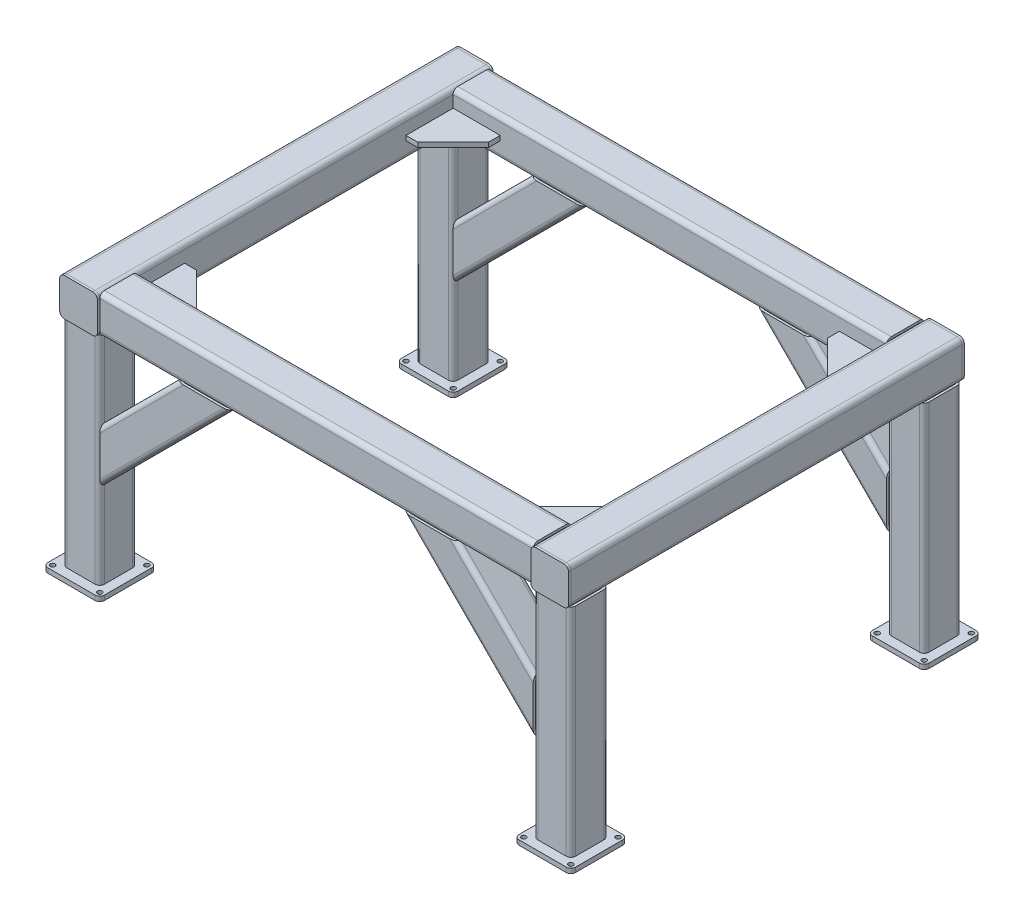
from build123d import *

# Parameters (mm, degrees)
SQUARE_TUBE_80_X_80_X_5_1_DEPTH      = 790
SQUARE_TUBE_80_X_80_X_5_1_DEPTH_BACK = 40
SQUARE_TUBE_80_X_80_X_5_1_2_DEPTH    = 830
SQUARE_TUBE_80_X_80_X_5_1_3_DEPTH    = 1002
SQUARE_TUBE_80_X_80_X_5_1_4_DEPTH    = 1002
SQUARE_TUBE_80_X_80_X_5_2_DEPTH      = 500
SQUARE_TUBE_80_X_80_X_5_2_2_DEPTH    = 500
SQUARE_TUBE_80_X_80_X_5_2_3_DEPTH    = 500
SQUARE_TUBE_80_X_80_X_5_2_4_DEPTH    = 500
SQUARE_TUBE_80_X_80_X_5_2_5_DEPTH    = 481.832611207
SQUARE_TUBE_80_X_80_X_5_2_6_DEPTH    = 481.832611207
SQUARE_TUBE_80_X_80_X_5_2_7_DEPTH    = 481.832611207
SQUARE_TUBE_80_X_80_X_5_2_8_DEPTH    = 481.832611207
END_CAP1_THICKNESS                   = 5
END_CAP1_4_THICKNESS                 = 5
END_CAP1_7_THICKNESS                 = 5
END_CAP1_10_THICKNESS                = 5
BOSS_EXTRUDE1_DEPTH                  = 10
BOSS_EXTRUDE1_2_DEPTH                = 10
BOSS_EXTRUDE1_3_DEPTH                = 10
BOSS_EXTRUDE1_4_DEPTH                = 10
SKETCH14_W                           = 5
SKETCH14_H                           = 550
F_10_0MM_DOWEL_HOLE1_AT_2_COUNT      = 2
F_10_0MM_DOWEL_HOLE1_AT_2_PITCH      = 100
F_10_0MM_DOWEL_HOLE1_AT_3_COUNT      = 2
F_10_0MM_DOWEL_HOLE1_AT_3_PITCH      = 100
F_10_0MM_DOWEL_HOLE1_AT_4_COUNT      = 2
F_10_0MM_DOWEL_HOLE1_AT_4_PITCH      = 141.421356237
F_10_0MM_DOWEL_HOLE1_AT_5_COUNT      = 2
F_10_0MM_DOWEL_HOLE1_AT_5_PITCH      = 750
F_10_0MM_DOWEL_HOLE1_AT_6_COUNT      = 2
F_10_0MM_DOWEL_HOLE1_AT_6_PITCH      = 756.637297521
F_10_0MM_DOWEL_HOLE1_AT_7_COUNT      = 2
F_10_0MM_DOWEL_HOLE1_AT_7_PITCH      = 855.862138431
F_10_0MM_DOWEL_HOLE1_AT_8_COUNT      = 2
F_10_0MM_DOWEL_HOLE1_AT_8_PITCH      = 850
MIRROR1_COPY_1_SKETCH_W              = 5
MIRROR1_COPY_1_SKETCH_H              = 550
MIRROR1_COPY_2_SKETCH_W              = 5
MIRROR1_COPY_2_SKETCH_H              = 550
MIRROR1_COPY_3_SKETCH_W              = 5
MIRROR1_COPY_3_SKETCH_H              = 550
MIRROR1_COPY_4_SKETCH_W              = 5
MIRROR1_COPY_4_SKETCH_H              = 550
MIRROR1_COPY_5_SKETCH_W              = 5
MIRROR1_COPY_5_SKETCH_H              = 550
MIRROR1_COPY_6_SKETCH_W              = 5
MIRROR1_COPY_6_SKETCH_H              = 550
MIRROR1_COPY_7_SKETCH_W              = 5
MIRROR1_COPY_7_SKETCH_H              = 550
GUSSET1_THICKNESS                    = 10
GUSSET2_THICKNESS                    = 10
MIRROR2_START                        = -5
MIRROR2_DEPTH                        = 10


# Read off the part's stored shape, not the designer's step: Mirror2
with BuildPart() as part:
    # Sketch11 → Square tube 80 X 80 X 5(1) (new, two sides: drawn at the far end of the back side and taken through both)
    with BuildSketch(Plane(origin=(500, 0, 375), x_dir=(-1, 0, 0), z_dir=(0, 0, -1)).offset(-SQUARE_TUBE_80_X_80_X_5_1_DEPTH_BACK)):
        with BuildLine():
            Line((-30, -40), (30, -40))
            ThreePointArc((30, -40), (37.071067812, -37.071067812), (40, -30))
            Line((40, -30), (40, 30))
            ThreePointArc((40, 30), (37.071067812, 37.071067812), (30, 40))
            Line((30, 40), (-30, 40))
            ThreePointArc((-30, 40), (-37.071067812, 37.071067812), (-40, 30))
            Line((-40, 30), (-40, -30))
            ThreePointArc((-40, -30), (-37.071067812, -37.071067812), (-30, -40))
        make_face()
        with BuildLine():
            Line((-30, -35), (30, -35))
            ThreePointArc((30, -35), (33.535533906, -33.535533906), (35, -30))
            Line((35, -30), (35, 30))
            ThreePointArc((35, 30), (33.535533906, 33.535533906), (30, 35))
            Line((30, 35), (-30, 35))
            ThreePointArc((-30, 35), (-33.535533906, 33.535533906), (-35, 30))
            Line((-35, 30), (-35, -30))
            ThreePointArc((-35, -30), (-33.535533906, -33.535533906), (-30, -35))
        make_face(mode=Mode.SUBTRACT)
    extrude(amount=SQUARE_TUBE_80_X_80_X_5_1_DEPTH + SQUARE_TUBE_80_X_80_X_5_1_DEPTH_BACK)


with BuildPart() as body_2:
    # Sketch11 on segment 2 (carried to segment 2) → Square tube 80 X 80 X 5_1 2 (new body)
    with BuildSketch(Plane(origin=(-500, 0, 415), x_dir=(-1, 0, 0), z_dir=(0, 0, -1))):
        with BuildLine():
            Line((-30, -40), (30, -40))
            ThreePointArc((30, -40), (37.071067812, -37.071067812), (40, -30))
            Line((40, -30), (40, 30))
            ThreePointArc((40, 30), (37.071067812, 37.071067812), (30, 40))
            Line((30, 40), (-30, 40))
            ThreePointArc((-30, 40), (-37.071067812, 37.071067812), (-40, 30))
            Line((-40, 30), (-40, -30))
            ThreePointArc((-40, -30), (-37.071067812, -37.071067812), (-30, -40))
        make_face()
        with BuildLine():
            Line((-30, -35), (30, -35))
            ThreePointArc((30, -35), (33.535533906, -33.535533906), (35, -30))
            Line((35, -30), (35, 30))
            ThreePointArc((35, 30), (33.535533906, 33.535533906), (30, 35))
            Line((30, 35), (-30, 35))
            ThreePointArc((-30, 35), (-33.535533906, 33.535533906), (-35, 30))
            Line((-35, 30), (-35, -30))
            ThreePointArc((-35, -30), (-33.535533906, -33.535533906), (-30, -35))
        make_face(mode=Mode.SUBTRACT)
    extrude(amount=SQUARE_TUBE_80_X_80_X_5_1_2_DEPTH)


with BuildPart() as body_3:
    # Sketch11 on segment 3 (carried to segment 3) → Square tube 80 X 80 X 5_1 3 (new body)
    with BuildSketch(Plane(origin=(-501, 0, 375), x_dir=(0, 0, -1), z_dir=(1, 0, 0))):
        with BuildLine():
            Line((-30, -40), (30, -40))
            ThreePointArc((30, -40), (37.071067812, -37.071067812), (40, -30))
            Line((40, -30), (40, 30))
            ThreePointArc((40, 30), (37.071067812, 37.071067812), (30, 40))
            Line((30, 40), (-30, 40))
            ThreePointArc((-30, 40), (-37.071067812, 37.071067812), (-40, 30))
            Line((-40, 30), (-40, -30))
            ThreePointArc((-40, -30), (-37.071067812, -37.071067812), (-30, -40))
        make_face()
        with BuildLine():
            Line((-30, -35), (30, -35))
            ThreePointArc((30, -35), (33.535533906, -33.535533906), (35, -30))
            Line((35, -30), (35, 30))
            ThreePointArc((35, 30), (33.535533906, 33.535533906), (30, 35))
            Line((30, 35), (-30, 35))
            ThreePointArc((-30, 35), (-33.535533906, 33.535533906), (-35, 30))
            Line((-35, 30), (-35, -30))
            ThreePointArc((-35, -30), (-33.535533906, -33.535533906), (-30, -35))
        make_face(mode=Mode.SUBTRACT)
    extrude(amount=SQUARE_TUBE_80_X_80_X_5_1_3_DEPTH)

    # Square tube 80 X 80 X 5_1 3 end butt 1
    split(bisect_by=Plane(origin=(-460, 0, 375), x_dir=(0, 1, 0), z_dir=(1, 0, 0)), keep=Keep.TOP)

    # Square tube 80 X 80 X 5_1 3 end butt 2
    split(bisect_by=Plane(origin=(460, 0, 375), x_dir=(0, -1, 0), z_dir=(-1, 0, 0)), keep=Keep.TOP)


with BuildPart() as body_4:
    # Sketch11 on segment 4 (carried to segment 4) → Square tube 80 X 80 X 5_1 4 (new body)
    with BuildSketch(Plane(origin=(-501, 0, -375), x_dir=(0, 0, -1), z_dir=(1, 0, 0))):
        with BuildLine():
            Line((-30, -40), (30, -40))
            ThreePointArc((30, -40), (37.071067812, -37.071067812), (40, -30))
            Line((40, -30), (40, 30))
            ThreePointArc((40, 30), (37.071067812, 37.071067812), (30, 40))
            Line((30, 40), (-30, 40))
            ThreePointArc((-30, 40), (-37.071067812, 37.071067812), (-40, 30))
            Line((-40, 30), (-40, -30))
            ThreePointArc((-40, -30), (-37.071067812, -37.071067812), (-30, -40))
        make_face()
        with BuildLine():
            Line((-30, -35), (30, -35))
            ThreePointArc((30, -35), (33.535533906, -33.535533906), (35, -30))
            Line((35, -30), (35, 30))
            ThreePointArc((35, 30), (33.535533906, 33.535533906), (30, 35))
            Line((30, 35), (-30, 35))
            ThreePointArc((-30, 35), (-33.535533906, 33.535533906), (-35, 30))
            Line((-35, 30), (-35, -30))
            ThreePointArc((-35, -30), (-33.535533906, -33.535533906), (-30, -35))
        make_face(mode=Mode.SUBTRACT)
    extrude(amount=SQUARE_TUBE_80_X_80_X_5_1_4_DEPTH)

    # Square tube 80 X 80 X 5_1 4 end butt 1
    split(bisect_by=Plane(origin=(-460, 0, -375), x_dir=(0, 1, 0), z_dir=(1, 0, 0)), keep=Keep.TOP)

    # Square tube 80 X 80 X 5_1 4 end butt 2
    split(bisect_by=Plane(origin=(460, 0, -375), x_dir=(0, -1, 0), z_dir=(-1, 0, 0)), keep=Keep.TOP)


with BuildPart() as body_5:
    # Sketch12 → Square tube 80 X 80 X 5(2) (new body)
    with BuildSketch(Plane(origin=(500, 0, -375), x_dir=(1, 0, 0), z_dir=(0, -1, 0))):
        with BuildLine():
            Line((-30, -40), (30, -40))
            ThreePointArc((30, -40), (37.071067812, -37.071067812), (40, -30))
            Line((40, -30), (40, 30))
            ThreePointArc((40, 30), (37.071067812, 37.071067812), (30, 40))
            Line((30, 40), (-30, 40))
            ThreePointArc((-30, 40), (-37.071067812, 37.071067812), (-40, 30))
            Line((-40, 30), (-40, -30))
            ThreePointArc((-40, -30), (-37.071067812, -37.071067812), (-30, -40))
        make_face()
        with BuildLine():
            Line((-30, -35), (30, -35))
            ThreePointArc((30, -35), (33.535533906, -33.535533906), (35, -30))
            Line((35, -30), (35, 30))
            ThreePointArc((35, 30), (33.535533906, 33.535533906), (30, 35))
            Line((30, 35), (-30, 35))
            ThreePointArc((-30, 35), (-33.535533906, 33.535533906), (-35, 30))
            Line((-35, 30), (-35, -30))
            ThreePointArc((-35, -30), (-33.535533906, -33.535533906), (-30, -35))
        make_face(mode=Mode.SUBTRACT)
    extrude(amount=SQUARE_TUBE_80_X_80_X_5_2_DEPTH)

    # Trim/Extend4
    split(bisect_by=Plane(origin=(500, -40, 0), x_dir=(1, 0, 0), z_dir=(0, -1, 0)), keep=Keep.TOP)


with BuildPart() as body_6:
    # Sketch12 on segment 2 (carried to segment 2) → Square tube 80 X 80 X 5_2 2 (new body)
    with BuildSketch(Plane(origin=(-500, 0, -375), x_dir=(1, 0, 0), z_dir=(0, -1, 0))):
        with BuildLine():
            Line((-30, -40), (30, -40))
            ThreePointArc((30, -40), (37.071067812, -37.071067812), (40, -30))
            Line((40, -30), (40, 30))
            ThreePointArc((40, 30), (37.071067812, 37.071067812), (30, 40))
            Line((30, 40), (-30, 40))
            ThreePointArc((-30, 40), (-37.071067812, 37.071067812), (-40, 30))
            Line((-40, 30), (-40, -30))
            ThreePointArc((-40, -30), (-37.071067812, -37.071067812), (-30, -40))
        make_face()
        with BuildLine():
            Line((-30, -35), (30, -35))
            ThreePointArc((30, -35), (33.535533906, -33.535533906), (35, -30))
            Line((35, -30), (35, 30))
            ThreePointArc((35, 30), (33.535533906, 33.535533906), (30, 35))
            Line((30, 35), (-30, 35))
            ThreePointArc((-30, 35), (-33.535533906, 33.535533906), (-35, 30))
            Line((-35, 30), (-35, -30))
            ThreePointArc((-35, -30), (-33.535533906, -33.535533906), (-30, -35))
        make_face(mode=Mode.SUBTRACT)
    extrude(amount=SQUARE_TUBE_80_X_80_X_5_2_2_DEPTH)

    # Trim_Extend3 5
    split(bisect_by=Plane(origin=(-500, -40, 0), x_dir=(1, 0, 0), z_dir=(0, -1, 0)), keep=Keep.TOP)


with BuildPart() as body_7:
    # Sketch12 on segment 3 (carried to segment 3) → Square tube 80 X 80 X 5_2 3 (new body)
    with BuildSketch(Plane(origin=(500, 0, 375), x_dir=(1, 0, 0), z_dir=(0, -1, 0))):
        with BuildLine():
            Line((-30, -40), (30, -40))
            ThreePointArc((30, -40), (37.071067812, -37.071067812), (40, -30))
            Line((40, -30), (40, 30))
            ThreePointArc((40, 30), (37.071067812, 37.071067812), (30, 40))
            Line((30, 40), (-30, 40))
            ThreePointArc((-30, 40), (-37.071067812, 37.071067812), (-40, 30))
            Line((-40, 30), (-40, -30))
            ThreePointArc((-40, -30), (-37.071067812, -37.071067812), (-30, -40))
        make_face()
        with BuildLine():
            Line((-30, -35), (30, -35))
            ThreePointArc((30, -35), (33.535533906, -33.535533906), (35, -30))
            Line((35, -30), (35, 30))
            ThreePointArc((35, 30), (33.535533906, 33.535533906), (30, 35))
            Line((30, 35), (-30, 35))
            ThreePointArc((-30, 35), (-33.535533906, 33.535533906), (-35, 30))
            Line((-35, 30), (-35, -30))
            ThreePointArc((-35, -30), (-33.535533906, -33.535533906), (-30, -35))
        make_face(mode=Mode.SUBTRACT)
    extrude(amount=SQUARE_TUBE_80_X_80_X_5_2_3_DEPTH)

    # Trim/Extend4
    split(bisect_by=Plane(origin=(500, -40, 0), x_dir=(1, 0, 0), z_dir=(0, -1, 0)), keep=Keep.TOP)


with BuildPart() as body_8:
    # Sketch12 on segment 4 (carried to segment 4) → Square tube 80 X 80 X 5_2 4 (new body)
    with BuildSketch(Plane(origin=(-500, 0, 375), x_dir=(1, 0, 0), z_dir=(0, -1, 0))):
        with BuildLine():
            Line((-30, -40), (30, -40))
            ThreePointArc((30, -40), (37.071067812, -37.071067812), (40, -30))
            Line((40, -30), (40, 30))
            ThreePointArc((40, 30), (37.071067812, 37.071067812), (30, 40))
            Line((30, 40), (-30, 40))
            ThreePointArc((-30, 40), (-37.071067812, 37.071067812), (-40, 30))
            Line((-40, 30), (-40, -30))
            ThreePointArc((-40, -30), (-37.071067812, -37.071067812), (-30, -40))
        make_face()
        with BuildLine():
            Line((-30, -35), (30, -35))
            ThreePointArc((30, -35), (33.535533906, -33.535533906), (35, -30))
            Line((35, -30), (35, 30))
            ThreePointArc((35, 30), (33.535533906, 33.535533906), (30, 35))
            Line((30, 35), (-30, 35))
            ThreePointArc((-30, 35), (-33.535533906, 33.535533906), (-35, 30))
            Line((-35, 30), (-35, -30))
            ThreePointArc((-35, -30), (-33.535533906, -33.535533906), (-30, -35))
        make_face(mode=Mode.SUBTRACT)
    extrude(amount=SQUARE_TUBE_80_X_80_X_5_2_4_DEPTH)

    # Trim_Extend2 5
    split(bisect_by=Plane(origin=(-500, -40, 0), x_dir=(1, 0, 0), z_dir=(0, -1, 0)), keep=Keep.TOP)


with BuildPart() as body_9:
    # Sketch12 on segment 5 (carried to segment 5) → Square tube 80 X 80 X 5_2 5 (new body)
    with BuildSketch(Plane(origin=(200, 0, -375), x_dir=(0.707106781, 0.707106781, 0), z_dir=(0.707106781, -0.707106781, 0))):
        with BuildLine():
            Line((-30, -40), (30, -40))
            ThreePointArc((30, -40), (37.071067812, -37.071067812), (40, -30))
            Line((40, -30), (40, 30))
            ThreePointArc((40, 30), (37.071067812, 37.071067812), (30, 40))
            Line((30, 40), (-30, 40))
            ThreePointArc((-30, 40), (-37.071067812, 37.071067812), (-40, 30))
            Line((-40, 30), (-40, -30))
            ThreePointArc((-40, -30), (-37.071067812, -37.071067812), (-30, -40))
        make_face()
        with BuildLine():
            Line((-30, -35), (30, -35))
            ThreePointArc((30, -35), (33.535533906, -33.535533906), (35, -30))
            Line((35, -30), (35, 30))
            ThreePointArc((35, 30), (33.535533906, 33.535533906), (30, 35))
            Line((30, 35), (-30, 35))
            ThreePointArc((-30, 35), (-33.535533906, 33.535533906), (-35, 30))
            Line((-35, 30), (-35, -30))
            ThreePointArc((-35, -30), (-33.535533906, -33.535533906), (-30, -35))
        make_face(mode=Mode.SUBTRACT)
    extrude(amount=SQUARE_TUBE_80_X_80_X_5_2_5_DEPTH)

    # Square tube 80 X 80 X 5_2 5 end butt 1
    split(bisect_by=Plane(origin=(460, -300, -375), x_dir=(0, -1, 0), z_dir=(-1, 0, 0)), keep=Keep.TOP)

    # Trim_Extend1 5
    split(bisect_by=Plane(origin=(0, -40, 375), x_dir=(1, 0, 0), z_dir=(0, -1, 0)), keep=Keep.TOP)


with BuildPart() as body_10:
    # Sketch12 on segment 6 (carried to segment 6) → Square tube 80 X 80 X 5_2 6 (new body)
    with BuildSketch(Plane(origin=(-200, 0, -375), x_dir=(0.707106781, -0.707106781, 0), z_dir=(-0.707106781, -0.707106781, 0))):
        with BuildLine():
            Line((-30, -40), (30, -40))
            ThreePointArc((30, -40), (37.071067812, -37.071067812), (40, -30))
            Line((40, -30), (40, 30))
            ThreePointArc((40, 30), (37.071067812, 37.071067812), (30, 40))
            Line((30, 40), (-30, 40))
            ThreePointArc((-30, 40), (-37.071067812, 37.071067812), (-40, 30))
            Line((-40, 30), (-40, -30))
            ThreePointArc((-40, -30), (-37.071067812, -37.071067812), (-30, -40))
        make_face()
        with BuildLine():
            Line((-30, -35), (30, -35))
            ThreePointArc((30, -35), (33.535533906, -33.535533906), (35, -30))
            Line((35, -30), (35, 30))
            ThreePointArc((35, 30), (33.535533906, 33.535533906), (30, 35))
            Line((30, 35), (-30, 35))
            ThreePointArc((-30, 35), (-33.535533906, 33.535533906), (-35, 30))
            Line((-35, 30), (-35, -30))
            ThreePointArc((-35, -30), (-33.535533906, -33.535533906), (-30, -35))
        make_face(mode=Mode.SUBTRACT)
    extrude(amount=SQUARE_TUBE_80_X_80_X_5_2_6_DEPTH)

    # Square tube 80 X 80 X 5_2 6 end butt 1
    split(bisect_by=Plane(origin=(-460, -300, -375), x_dir=(0, 1, 0), z_dir=(1, 0, 0)), keep=Keep.TOP)

    # Trim_Extend1 5
    split(bisect_by=Plane(origin=(0, -40, 375), x_dir=(1, 0, 0), z_dir=(0, -1, 0)), keep=Keep.TOP)


with BuildPart() as body_11:
    # Sketch12 on segment 7 (carried to segment 7) → Square tube 80 X 80 X 5_2 7 (new body)
    with BuildSketch(Plane(origin=(200, 0, 375), x_dir=(0.707106781, 0.707106781, 0), z_dir=(0.707106781, -0.707106781, 0))):
        with BuildLine():
            Line((-30, -40), (30, -40))
            ThreePointArc((30, -40), (37.071067812, -37.071067812), (40, -30))
            Line((40, -30), (40, 30))
            ThreePointArc((40, 30), (37.071067812, 37.071067812), (30, 40))
            Line((30, 40), (-30, 40))
            ThreePointArc((-30, 40), (-37.071067812, 37.071067812), (-40, 30))
            Line((-40, 30), (-40, -30))
            ThreePointArc((-40, -30), (-37.071067812, -37.071067812), (-30, -40))
        make_face()
        with BuildLine():
            Line((-30, -35), (30, -35))
            ThreePointArc((30, -35), (33.535533906, -33.535533906), (35, -30))
            Line((35, -30), (35, 30))
            ThreePointArc((35, 30), (33.535533906, 33.535533906), (30, 35))
            Line((30, 35), (-30, 35))
            ThreePointArc((-30, 35), (-33.535533906, 33.535533906), (-35, 30))
            Line((-35, 30), (-35, -30))
            ThreePointArc((-35, -30), (-33.535533906, -33.535533906), (-30, -35))
        make_face(mode=Mode.SUBTRACT)
    extrude(amount=SQUARE_TUBE_80_X_80_X_5_2_7_DEPTH)

    # Square tube 80 X 80 X 5_2 7 end butt 1
    split(bisect_by=Plane(origin=(460, -300, 375), x_dir=(0, -1, 0), z_dir=(-1, 0, 0)), keep=Keep.TOP)

    # Trim_Extend1 5
    split(bisect_by=Plane(origin=(0, -40, 375), x_dir=(1, 0, 0), z_dir=(0, -1, 0)), keep=Keep.TOP)


with BuildPart() as body_12:
    # Sketch12 on segment 8 (carried to segment 8) → Square tube 80 X 80 X 5_2 8 (new body)
    with BuildSketch(Plane(origin=(-200, 0, 375), x_dir=(0.707106781, -0.707106781, 0), z_dir=(-0.707106781, -0.707106781, 0))):
        with BuildLine():
            Line((-30, -40), (30, -40))
            ThreePointArc((30, -40), (37.071067812, -37.071067812), (40, -30))
            Line((40, -30), (40, 30))
            ThreePointArc((40, 30), (37.071067812, 37.071067812), (30, 40))
            Line((30, 40), (-30, 40))
            ThreePointArc((-30, 40), (-37.071067812, 37.071067812), (-40, 30))
            Line((-40, 30), (-40, -30))
            ThreePointArc((-40, -30), (-37.071067812, -37.071067812), (-30, -40))
        make_face()
        with BuildLine():
            Line((-30, -35), (30, -35))
            ThreePointArc((30, -35), (33.535533906, -33.535533906), (35, -30))
            Line((35, -30), (35, 30))
            ThreePointArc((35, 30), (33.535533906, 33.535533906), (30, 35))
            Line((30, 35), (-30, 35))
            ThreePointArc((-30, 35), (-33.535533906, 33.535533906), (-35, 30))
            Line((-35, 30), (-35, -30))
            ThreePointArc((-35, -30), (-33.535533906, -33.535533906), (-30, -35))
        make_face(mode=Mode.SUBTRACT)
    extrude(amount=SQUARE_TUBE_80_X_80_X_5_2_8_DEPTH)

    # Square tube 80 X 80 X 5_2 8 end butt 1
    split(bisect_by=Plane(origin=(-460, -300, 375), x_dir=(0, 1, 0), z_dir=(1, 0, 0)), keep=Keep.TOP)

    # Trim_Extend1 5
    split(bisect_by=Plane(origin=(0, -40, 375), x_dir=(1, 0, 0), z_dir=(0, -1, 0)), keep=Keep.TOP)


with BuildPart() as body_13:
    # End cap1: an end cap: a plate 5.0 thick on the member's open end, its outline the end's outer outline
    end_cap1_end = part.part.faces().sort_by_distance((529.1, -38.8, -415))[0]
    add(extrude(Face(end_cap1_end.outer_wire()), amount=END_CAP1_THICKNESS, dir=(0, 0, -1)))


with BuildPart() as body_14:
    # End cap1 4: an end cap: a plate 5.0 thick on the member's open end, its outline the end's outer outline
    end_cap1_4_end = body_2.part.faces().sort_by_distance((-470.9, -38.8, -415))[0]
    add(extrude(Face(end_cap1_4_end.outer_wire()), amount=END_CAP1_4_THICKNESS, dir=(0, 0, -1)))


with BuildPart() as body_15:
    # End cap1 7: an end cap: a plate 5.0 thick on the member's open end, its outline the end's outer outline
    end_cap1_7_end = part.part.faces().sort_by_distance((470.9, -38.8, 415))[0]
    add(extrude(Face(end_cap1_7_end.outer_wire()), amount=END_CAP1_7_THICKNESS, dir=(0, 0, 1)))


with BuildPart() as body_16:
    # End cap1 10: an end cap: a plate 5.0 thick on the member's open end, its outline the end's outer outline
    end_cap1_10_end = body_2.part.faces().sort_by_distance((-529.1, -38.8, 415))[0]
    add(extrude(Face(end_cap1_10_end.outer_wire()), amount=END_CAP1_10_THICKNESS, dir=(0, 0, 1)))


with BuildPart() as body_17:
    # Sketch13 → Boss-Extrude1 (new body)
    with BuildSketch(Plane.XZ.offset(500)):
        with BuildLine():
            Line((550, 315), (450, 315))
            ThreePointArc((450, 315), (442.928932188, 317.928932188), (440, 325))
            Line((440, 325), (440, 425))
            ThreePointArc((440, 425), (442.928932188, 432.071067812), (450, 435))
            Line((450, 435), (550, 435))
            ThreePointArc((550, 435), (557.071067812, 432.071067812), (560, 425))
            Line((560, 425), (560, 325))
            ThreePointArc((560, 325), (557.071067812, 317.928932188), (550, 315))
        make_face()
    extrude(amount=BOSS_EXTRUDE1_DEPTH)


with BuildPart() as body_18:
    # Sketch13 → Boss-Extrude1 2 (new body)
    with BuildSketch(Plane.XZ.offset(500)):
        with BuildLine():
            Line((-450, 315), (-550, 315))
            ThreePointArc((-550, 315), (-557.071067812, 317.928932188), (-560, 325))
            Line((-560, 325), (-560, 425))
            ThreePointArc((-560, 425), (-557.071067812, 432.071067812), (-550, 435))
            Line((-550, 435), (-450, 435))
            ThreePointArc((-450, 435), (-442.928932188, 432.071067812), (-440, 425))
            Line((-440, 425), (-440, 325))
            ThreePointArc((-440, 325), (-442.928932188, 317.928932188), (-450, 315))
        make_face()
    extrude(amount=BOSS_EXTRUDE1_2_DEPTH)

    # Sketch14 → Ø10.0mm Dowel Hole1 (revolve, cut)
    with BuildSketch(Plane(origin=(-550, -510, 425), x_dir=(0, 0, -1), z_dir=(1, 0, 0))):
        with Locations((2.5, 275)):
            Rectangle(SKETCH14_W, SKETCH14_H)
    f_10_0mm_dowel_hole1 = revolve(axis=Axis((-550, -516.35, 425), (0, 1, 0)), mode=Mode.SUBTRACT)

    # Ø10.0mm Dowel Hole1 at 2: Ø10.0mm Dowel Hole1 ×2
    with Locations(*[(i * F_10_0MM_DOWEL_HOLE1_AT_2_PITCH, 0, 0) for i in range(1, F_10_0MM_DOWEL_HOLE1_AT_2_COUNT)]):
        add(f_10_0mm_dowel_hole1, mode=Mode.SUBTRACT)

    # Ø10.0mm Dowel Hole1 at 3: Ø10.0mm Dowel Hole1 ×2
    with Locations(*[(0, 0, -i * F_10_0MM_DOWEL_HOLE1_AT_3_PITCH) for i in range(1, F_10_0MM_DOWEL_HOLE1_AT_3_COUNT)]):
        add(f_10_0mm_dowel_hole1, mode=Mode.SUBTRACT)

    # Ø10.0mm Dowel Hole1 at 4: Ø10.0mm Dowel Hole1 ×2
    with Locations(*[Vector(0.7071067811865474, 0, -0.7071067811865478) * (i * F_10_0MM_DOWEL_HOLE1_AT_4_PITCH) for i in range(1, F_10_0MM_DOWEL_HOLE1_AT_4_COUNT)]):
        add(f_10_0mm_dowel_hole1, mode=Mode.SUBTRACT)


with BuildPart() as body_19:
    # Sketch13 → Boss-Extrude1 3 (new body)
    with BuildSketch(Plane.XZ.offset(500)):
        with BuildLine():
            Line((-450, -435), (-550, -435))
            ThreePointArc((-550, -435), (-557.071067812, -432.071067812), (-560, -425))
            Line((-560, -425), (-560, -325))
            ThreePointArc((-560, -325), (-557.071067812, -317.928932188), (-550, -315))
            Line((-550, -315), (-450, -315))
            ThreePointArc((-450, -315), (-442.928932188, -317.928932188), (-440, -325))
            Line((-440, -325), (-440, -425))
            ThreePointArc((-440, -425), (-442.928932188, -432.071067812), (-450, -435))
        make_face()
    extrude(amount=BOSS_EXTRUDE1_3_DEPTH)

    # Ø10.0mm Dowel Hole1 at 5: Ø10.0mm Dowel Hole1 ×2
    with Locations(*[(0, 0, -i * F_10_0MM_DOWEL_HOLE1_AT_5_PITCH) for i in range(1, F_10_0MM_DOWEL_HOLE1_AT_5_COUNT)]):
        add(f_10_0mm_dowel_hole1, mode=Mode.SUBTRACT)

    # Ø10.0mm Dowel Hole1 at 6: Ø10.0mm Dowel Hole1 ×2
    with Locations(*[Vector(0.13216372009101782, 0, -0.9912279006826348) * (i * F_10_0MM_DOWEL_HOLE1_AT_6_PITCH) for i in range(1, F_10_0MM_DOWEL_HOLE1_AT_6_COUNT)]):
        add(f_10_0mm_dowel_hole1, mode=Mode.SUBTRACT)

    # Ø10.0mm Dowel Hole1 at 7: Ø10.0mm Dowel Hole1 ×2
    with Locations(*[Vector(0.11684124756739707, 0, -0.9931506043228763) * (i * F_10_0MM_DOWEL_HOLE1_AT_7_PITCH) for i in range(1, F_10_0MM_DOWEL_HOLE1_AT_7_COUNT)]):
        add(f_10_0mm_dowel_hole1, mode=Mode.SUBTRACT)

    # Ø10.0mm Dowel Hole1 at 8: Ø10.0mm Dowel Hole1 ×2
    with Locations(*[(0, 0, -i * F_10_0MM_DOWEL_HOLE1_AT_8_PITCH) for i in range(1, F_10_0MM_DOWEL_HOLE1_AT_8_COUNT)]):
        add(f_10_0mm_dowel_hole1, mode=Mode.SUBTRACT)


with BuildPart() as body_20:
    # Sketch13 → Boss-Extrude1 4 (new body)
    with BuildSketch(Plane.XZ.offset(500)):
        with BuildLine():
            Line((450, -435), (550, -435))
            ThreePointArc((550, -435), (557.071067812, -432.071067812), (560, -425))
            Line((560, -425), (560, -325))
            ThreePointArc((560, -325), (557.071067812, -317.928932188), (550, -315))
            Line((550, -315), (450, -315))
            ThreePointArc((450, -315), (442.928932188, -317.928932188), (440, -325))
            Line((440, -325), (440, -425))
            ThreePointArc((440, -425), (442.928932188, -432.071067812), (450, -435))
        make_face()
    extrude(amount=BOSS_EXTRUDE1_4_DEPTH)

    # Mirror1 copy 4 sketch → Mirror1 copy 4 (revolve, cut)
    with BuildSketch(Plane(origin=(550, -510, -325), x_dir=(0, 0, -1), z_dir=(-1, 0, 0))):
        with Locations((2.5, -275)):
            Rectangle(MIRROR1_COPY_4_SKETCH_W, MIRROR1_COPY_4_SKETCH_H)
    revolve(axis=Axis((550, -516.35, -325), (0, -1, 0)), mode=Mode.SUBTRACT)

    # Mirror1 copy 5 sketch → Mirror1 copy 5 (revolve, cut)
    with BuildSketch(Plane(origin=(450, -510, -325), x_dir=(0, 0, -1), z_dir=(-1, 0, 0))):
        with Locations((2.5, -275)):
            Rectangle(MIRROR1_COPY_5_SKETCH_W, MIRROR1_COPY_5_SKETCH_H)
    revolve(axis=Axis((450, -516.35, -325), (0, -1, 0)), mode=Mode.SUBTRACT)

    # Mirror1 copy 6 sketch → Mirror1 copy 6 (revolve, cut)
    with BuildSketch(Plane(origin=(450, -510, -425), x_dir=(0, 0, -1), z_dir=(-1, 0, 0))):
        with Locations((2.5, -275)):
            Rectangle(MIRROR1_COPY_6_SKETCH_W, MIRROR1_COPY_6_SKETCH_H)
    revolve(axis=Axis((450, -516.35, -425), (0, -1, 0)), mode=Mode.SUBTRACT)

    # Mirror1 copy 7 sketch → Mirror1 copy 7 (revolve, cut)
    with BuildSketch(Plane(origin=(550, -510, -425), x_dir=(0, 0, -1), z_dir=(-1, 0, 0))):
        with Locations((2.5, -275)):
            Rectangle(MIRROR1_COPY_7_SKETCH_W, MIRROR1_COPY_7_SKETCH_H)
    revolve(axis=Axis((550, -516.35, -425), (0, -1, 0)), mode=Mode.SUBTRACT)


with BuildPart() as body_17_1:
    add(body_17.part)

    # Mirror1: Ø10.0mm Dowel Hole1 across plane
    add(f_10_0mm_dowel_hole1.mirror(Plane(origin=(0, 0, 0), x_dir=(0, 0, 1), z_dir=(1, 0, 0))), mode=Mode.SUBTRACT)

    # Mirror1 copy 1 sketch → Mirror1 copy 1 (revolve, cut)
    with BuildSketch(Plane(origin=(450, -510, 425), x_dir=(0, 0, -1), z_dir=(-1, 0, 0))):
        with Locations((2.5, -275)):
            Rectangle(MIRROR1_COPY_1_SKETCH_W, MIRROR1_COPY_1_SKETCH_H)
    revolve(axis=Axis((450, -516.35, 425), (0, -1, 0)), mode=Mode.SUBTRACT)

    # Mirror1 copy 2 sketch → Mirror1 copy 2 (revolve, cut)
    with BuildSketch(Plane(origin=(550, -510, 325), x_dir=(0, 0, -1), z_dir=(-1, 0, 0))):
        with Locations((2.5, -275)):
            Rectangle(MIRROR1_COPY_2_SKETCH_W, MIRROR1_COPY_2_SKETCH_H)
    revolve(axis=Axis((550, -516.35, 325), (0, -1, 0)), mode=Mode.SUBTRACT)

    # Mirror1 copy 3 sketch → Mirror1 copy 3 (revolve, cut)
    with BuildSketch(Plane(origin=(450, -510, 325), x_dir=(0, 0, -1), z_dir=(-1, 0, 0))):
        with Locations((2.5, -275)):
            Rectangle(MIRROR1_COPY_3_SKETCH_W, MIRROR1_COPY_3_SKETCH_H)
    revolve(axis=Axis((450, -516.35, 325), (0, -1, 0)), mode=Mode.SUBTRACT)


with BuildPart() as body_21:
    # Gusset1: a gusset: a plate 10.0 thick in the corner of two members, its outline drawn in place
    gusset1_outline = Wire([Line((460, 5, 335), (460, 5, 235)), Line((460, 5, 235), (435, 5, 235)), Line((435, 5, 235), (360, 5, 310)), Line((360, 5, 310), (360, 5, 335)), Line((360, 5, 335), (460, 5, 335))])
    add(extrude(Face(gusset1_outline), amount=GUSSET1_THICKNESS, dir=(0, -1, 0)))


with BuildPart() as body_22:
    # Gusset2: a gusset: a plate 10.0 thick in the corner of two members, its outline drawn in place
    gusset2_outline = Wire([Line((460, -5, -335), (460, -5, -235)), Line((460, -5, -235), (435, -5, -235)), Line((435, -5, -235), (360, -5, -310)), Line((360, -5, -310), (360, -5, -335)), Line((360, -5, -335), (460, -5, -335))])
    add(extrude(Face(gusset2_outline), amount=GUSSET2_THICKNESS, dir=(0, 1, 0)))


with BuildPart() as body_2_1:
    add(body_2.part)

    add(body_3.part)  # Mirror2 merges body 3

    add(body_4.part)  # Mirror2 merges body 4
    # Mirror2 outline → Mirror2 (add)
    with BuildSketch(Plane(origin=(0, 0, 0), x_dir=(1, 0, 0), z_dir=(0, 1, 0)).offset(MIRROR2_START)):
        Polygon((-435, -235), (-460, -235), (-460, -335), (-360, -335), (-360, -310), align=None)
        Polygon((-460, 235), (-435, 235), (-360, 310), (-360, 335), (-460, 335), align=None)
    extrude(amount=MIRROR2_DEPTH)


solid = Compound([part.part, body_5.part, body_6.part, body_7.part, body_8.part, body_9.part, body_10.part, body_11.part, body_12.part, body_13.part, body_14.part, body_15.part, body_16.part, body_18.part, body_19.part, body_20.part, body_17_1.part, body_21.part, body_22.part, body_2_1.part])
